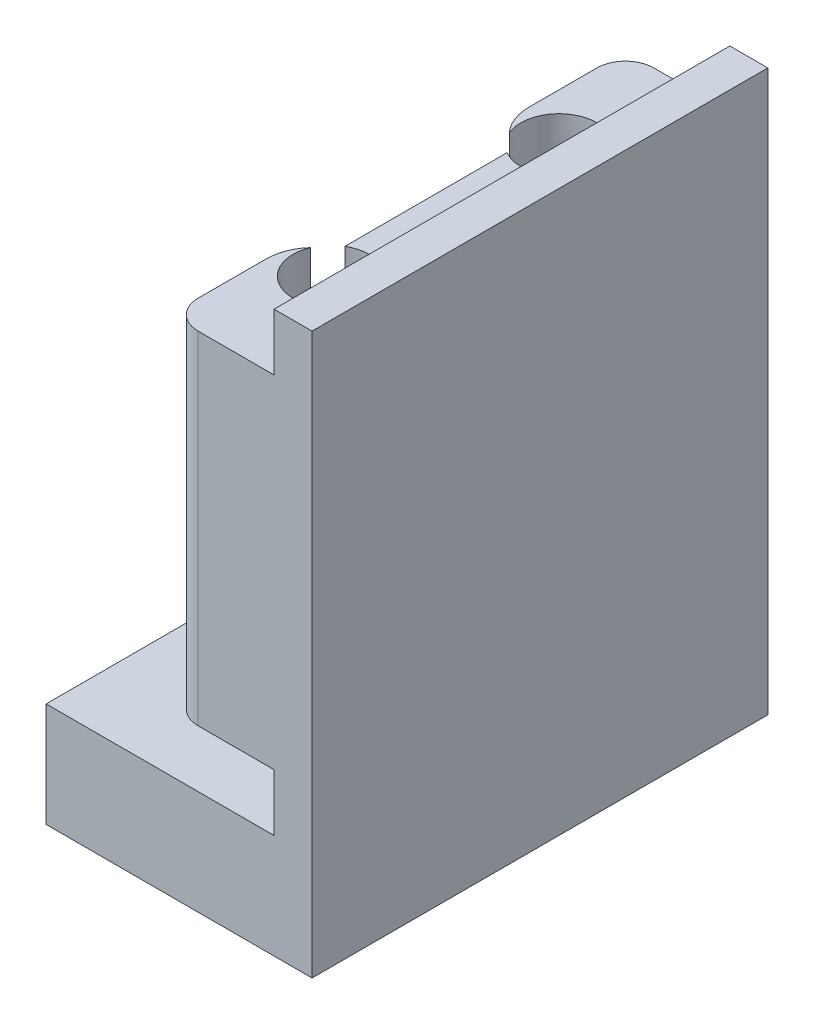
from build123d import *

# Parameters (mm, degrees)
SKETCH1_W           = 12
SKETCH1_H           = 24
BOSS_EXTRUDE1_DEPTH = 5.5
SKETCH2_W           = 2
SKETCH2_H           = 24
BOSS_EXTRUDE2_DEPTH = 29.5
BOSS_EXTRUDE4_START = 3
SKETCH4_W           = 5.5
SKETCH4_H           = 24
BOSS_EXTRUDE4_DEPTH = 18
SKETCH5_W           = 9.25
SKETCH5_H           = 18
CUT_EXTRUDE1_DEPTH  = 1.5
FILLET1_R           = 2.5
SKETCH6_R           = 2
CUT_EXTRUDE2_DEPTH  = 31.170349683
FILLET2_R           = 1.5


with BuildPart() as part:
    # Sketch1 → Boss-Extrude1 (new body)
    with BuildSketch(Plane(origin=(0, 0, 0), x_dir=(1, 0, 0), z_dir=(0, 1, 0))):
        Rectangle(SKETCH1_W, SKETCH1_H)
    extrude(amount=BOSS_EXTRUDE1_DEPTH)

    # Sketch2 → Boss-Extrude2 (add)
    with BuildSketch(Plane(origin=(0, 0, 0), x_dir=(1, 0, 0), z_dir=(0, 1, 0))):
        with Locations((7, 0)):
            Rectangle(SKETCH2_W, SKETCH2_H)
    extrude(amount=BOSS_EXTRUDE2_DEPTH)

    # Sketch4 → Boss-Extrude4 (add)
    with BuildSketch(Plane(origin=(0, 5.5, 0), x_dir=(1, 0, 0), z_dir=(0, 1, 0)).offset(BOSS_EXTRUDE4_START)):
        with Locations((3.25, 0)):
            Rectangle(SKETCH4_W, SKETCH4_H)
    extrude(amount=BOSS_EXTRUDE4_DEPTH)

    # Sketch5 → Cut-Extrude1 (cut)
    with BuildSketch(Plane.ZY.offset(-0.5)):
        with Locations((0, 17.5)):
            Rectangle(SKETCH5_W, SKETCH5_H)
    extrude(amount=-CUT_EXTRUDE1_DEPTH, mode=Mode.SUBTRACT)

    # Fillet1
    # the kernel refuses this fillet: 2.5 mm, written as the material it takes off along each edge
    with BuildSketch(Plane(origin=(0.5, 32.228219619, 4.625), x_dir=(0, 0, 1), z_dir=(0, -1, 0)), Plane(origin=(0.5, 8.5, -4.625), x_dir=(0, 0, -1), z_dir=(0, 1, 0))) as fillet1_piece_1:
        with BuildLine():
            CenterArc((2.291287847, -2.5), FILLET1_R, 90, 66.421821522)
            Line((0, -1.5), (0, 0))
            Line((0, 0), (2.291287847, 0))
        make_face()
    extrude(amount=23.728219619, mode=Mode.SUBTRACT)

    # Sketch6 → Cut-Extrude2 (cut, through all)
    with BuildSketch(Plane(origin=(0, 26.5, 0), x_dir=(1, 0, 0), z_dir=(0, 1, 0))):
        with Locations(Location((3, -6, 0), (0, 0, 270))):
            Circle(SKETCH6_R)
        with Locations(Location((3, 6, 0), (0, 0, 90))):
            Circle(SKETCH6_R)
    extrude(amount=-CUT_EXTRUDE2_DEPTH, mode=Mode.SUBTRACT)

    # Fillet2
    fillet2_edges = [part.edges().sort_by_distance(p)[0] for p in [
        (0.5, 17.5, -12),
        (0.5, 17.5, 12),
    ]]
    fillet(fillet2_edges, radius=FILLET2_R)


solid = part.part
